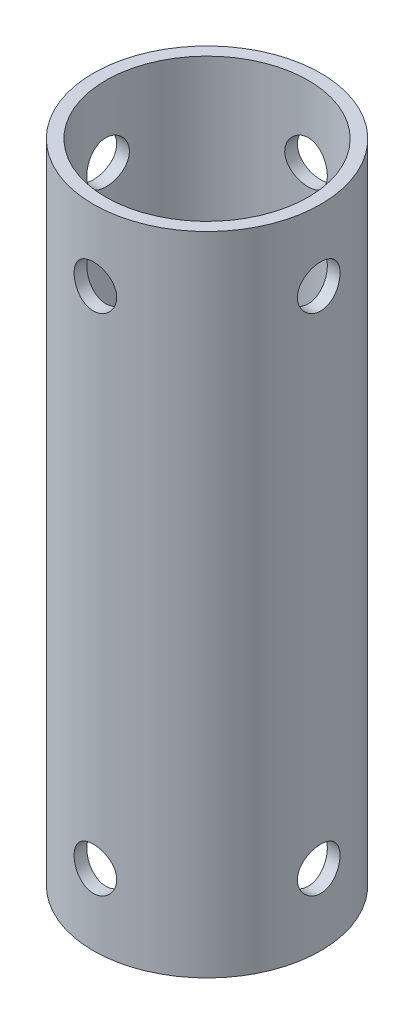
from build123d import *

# Parameters (mm, degrees)
SKETCH1_R           = 16
SKETCH1_R_2         = 14.25
BOSS_EXTRUDE1_DEPTH = 91
SKETCH2_R           = 3
CUT_EXTRUDE1_DEPTH  = 10
CIRPATTERN1_COUNT   = 4


with BuildPart() as part:
    # Sketch1 → Boss-Extrude1 (new body)
    with BuildSketch(Plane(origin=(0, 0, 0), x_dir=(1, 0, 0), z_dir=(0, 1, 0))):
        Circle(SKETCH1_R)
        Circle(SKETCH1_R_2, mode=Mode.SUBTRACT)
    extrude(amount=BOSS_EXTRUDE1_DEPTH)

    # Sketch2 → Cut-Extrude1 (cut)
    with BuildSketch(Plane(origin=(0, 0, -16), x_dir=(-1, 0, 0), z_dir=(0, 0, -1))):
        with Locations((0, 10)):
            Circle(SKETCH2_R)
        with Locations((0, 81)):
            Circle(SKETCH2_R)
    cut_extrude1 = extrude(amount=-CUT_EXTRUDE1_DEPTH, mode=Mode.SUBTRACT)

    # CirPattern1: Cut-Extrude1 ×4 about axis
    cirpattern1_axis = Axis((0, 91, 0), (0, -1, 0))
    for i in range(1, CIRPATTERN1_COUNT):
        add(cut_extrude1.rotate(cirpattern1_axis, i * 360 / CIRPATTERN1_COUNT), mode=Mode.SUBTRACT)


solid = part.part
